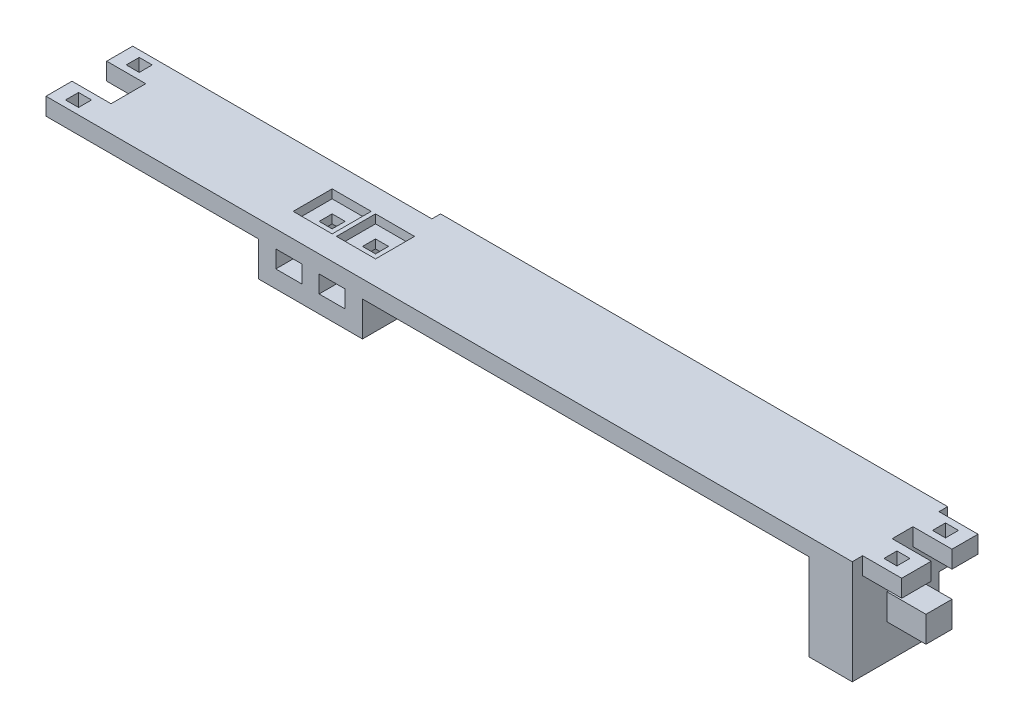
from build123d import *

# Parameters (mm, degrees)
SKETCH2_W           = 194.96
SKETCH2_H           = 6
BOSS_EXTRUDE1_DEPTH = 4
SKETCH3_W           = 176.96
SKETCH3_H           = 4
BOSS_EXTRUDE2_DEPTH = 14
SKETCH4_W           = 6
SKETCH4_H           = 4
BOSS_EXTRUDE3_DEPTH = 9
SKETCH5_W           = 6.8
SKETCH5_H           = 4
BOSS_EXTRUDE4_DEPTH = 9
CUT_EXTRUDE1_REACH  = 197.503
SKETCH6_W           = 3
SKETCH6_H           = 3
SKETCH7_W           = 10
SKETCH7_H           = 20
BOSS_EXTRUDE5_DEPTH = 20
SKETCH8_W           = 136.96
SKETCH8_H           = 6
BOSS_EXTRUDE6_DEPTH = 8
CHAMFER1_SIZE2      = 14.301043111
CHAMFER1_SIZE       = 12
BOSS_EXTRUDE7_DEPTH = 14
CUT_EXTRUDE2_REACH  = 199.001
SKETCH10_W          = 6
SKETCH10_H          = 4
CUT_EXTRUDE3_REACH  = 198.93
SKETCH11_W          = 3
SKETCH11_H          = 3
SKETCH12_W          = 116.96
SKETCH12_H          = 12
BOSS_EXTRUDE8_DEPTH = 2
SKETCH13_W          = 6
SKETCH13_H          = 6
BOSS_EXTRUDE9_DEPTH = 9
SKETCH14_W          = 9
SKETCH14_H          = 9
CUT_EXTRUDE4_DEPTH  = 2


with BuildPart() as part:
    # Sketch2 → Boss-Extrude1 (new body)
    with BuildSketch(Plane(origin=(0, 0, 0), x_dir=(1, 0, 0), z_dir=(0, 1, 0))):
        with Locations((97.48, 3)):
            Rectangle(SKETCH2_W, SKETCH2_H)
    extrude(amount=BOSS_EXTRUDE1_DEPTH)

    # Sketch3 → Boss-Extrude2 (add)
    with BuildSketch(Plane(origin=(0, 0, 0), x_dir=(-1, 0, 0), z_dir=(0, 0, -1))):
        with Locations((-97.48, 2)):
            Rectangle(SKETCH3_W, SKETCH3_H)
    extrude(amount=-BOSS_EXTRUDE2_DEPTH)

    # Sketch4 → Boss-Extrude3 (add)
    with BuildSketch(Plane.ZY.offset(-9)):
        with Locations((11, 2)):
            Rectangle(SKETCH4_W, SKETCH4_H)
    extrude(amount=BOSS_EXTRUDE3_DEPTH)

    # Sketch5 → Boss-Extrude4 (add)
    with BuildSketch(Plane(origin=(185.96, 0, 0), x_dir=(0, 0, -1), z_dir=(1, 0, 0))):
        with Locations((-8.2, 2)):
            Rectangle(SKETCH5_W, SKETCH5_H)
    extrude(amount=BOSS_EXTRUDE4_DEPTH)

    # Sketch6 → Cut-Extrude1 (cut, up to next)
    with BuildSketch(Plane(origin=(0, 4, 0), x_dir=(1, 0, 0), z_dir=(0, 1, 0)), mode=Mode.PRIVATE) as cut_extrude1_sk1:
        with Locations((4.5, 3)):
            Rectangle(SKETCH6_W, SKETCH6_H)
    cut_extrude1_tool1 = extrude(cut_extrude1_sk1.sketch, amount=-CUT_EXTRUDE1_REACH, mode=Mode.PRIVATE) & part.part
    # Sketch6 → Cut-Extrude1 (cut, up to next)
    with BuildSketch(Plane(origin=(0, 4, 0), x_dir=(1, 0, 0), z_dir=(0, 1, 0)), mode=Mode.PRIVATE) as cut_extrude1_sk2:
        with Locations((4.5, -11)):
            Rectangle(SKETCH6_W, SKETCH6_H)
    cut_extrude1_tool2 = extrude(cut_extrude1_sk2.sketch, amount=-CUT_EXTRUDE1_REACH, mode=Mode.PRIVATE) & part.part
    # Sketch6 → Cut-Extrude1 (cut, up to next)
    with BuildSketch(Plane(origin=(0, 4, 0), x_dir=(1, 0, 0), z_dir=(0, 1, 0)), mode=Mode.PRIVATE) as cut_extrude1_sk3:
        with Locations((190.46, 3)):
            Rectangle(SKETCH6_W, SKETCH6_H)
    cut_extrude1_tool3 = extrude(cut_extrude1_sk3.sketch, amount=-CUT_EXTRUDE1_REACH, mode=Mode.PRIVATE) & part.part
    # Sketch6 → Cut-Extrude1 (cut, up to next)
    with BuildSketch(Plane(origin=(0, 4, 0), x_dir=(1, 0, 0), z_dir=(0, 1, 0)), mode=Mode.PRIVATE) as cut_extrude1_sk4:
        with Locations((190.46, -8.2)):
            Rectangle(SKETCH6_W, SKETCH6_H)
    cut_extrude1_tool4 = extrude(cut_extrude1_sk4.sketch, amount=-CUT_EXTRUDE1_REACH, mode=Mode.PRIVATE) & part.part
    add(cut_extrude1_tool1.solids().sort_by_distance((4.5, 4, -3))[0], mode=Mode.SUBTRACT)
    add(cut_extrude1_tool2.solids().sort_by_distance((4.5, 4, 11))[0], mode=Mode.SUBTRACT)
    add(cut_extrude1_tool3.solids().sort_by_distance((190.46, 4, -3))[0], mode=Mode.SUBTRACT)
    add(cut_extrude1_tool4.solids().sort_by_distance((190.46, 4, 8.2))[0], mode=Mode.SUBTRACT)

    # Sketch7 → Boss-Extrude5 (add)
    with BuildSketch(Plane.XZ):
        with Locations((180.96, 4)):
            Rectangle(SKETCH7_W, SKETCH7_H)
    extrude(amount=BOSS_EXTRUDE5_DEPTH)

    # Sketch8 → Boss-Extrude6 (add)
    with BuildSketch(Plane.XZ):
        with Locations((117.48, -3)):
            Rectangle(SKETCH8_W, SKETCH8_H)
    extrude(amount=BOSS_EXTRUDE6_DEPTH)

    # Chamfer1
    chamfer1_edges = [part.edges().sort_by_distance(p)[0] for p in [
        (175.96, -8, -3),
    ]]
    chamfer1_side = [part.faces().sort_by_distance(p)[0] for p in [
        (175.96, -8.24, -3),
    ]]
    chamfer(chamfer1_edges, length=CHAMFER1_SIZE - 0.0001, length2=CHAMFER1_SIZE2 - 0.0001, reference=chamfer1_side[0])  # a hair under: the kernel refuses the full size

    # Sketch9 → Boss-Extrude7 (add)
    with BuildSketch(Plane.XY):
        Polygon((49, -8), (55, -8), (61, -8), (73, -8), (73, 0), (61, 0), (55, 0), (49, 0), align=None)
    extrude(amount=BOSS_EXTRUDE7_DEPTH)

    # Sketch10 → Cut-Extrude2 (cut, up to next)
    with BuildSketch(Plane.XY.offset(14), mode=Mode.PRIVATE) as cut_extrude2_sk1:
        with Locations((56, -2)):
            Rectangle(SKETCH10_W, SKETCH10_H)
    cut_extrude2_tool1 = extrude(cut_extrude2_sk1.sketch, amount=-CUT_EXTRUDE2_REACH, mode=Mode.PRIVATE) & part.part
    # Sketch10 → Cut-Extrude2 (cut, up to next)
    with BuildSketch(Plane.XY.offset(14), mode=Mode.PRIVATE) as cut_extrude2_sk2:
        with Locations((66, -2)):
            Rectangle(SKETCH10_W, SKETCH10_H)
    cut_extrude2_tool2 = extrude(cut_extrude2_sk2.sketch, amount=-CUT_EXTRUDE2_REACH, mode=Mode.PRIVATE) & part.part
    add(cut_extrude2_tool1.solids().sort_by_distance((56, -2, 14))[0], mode=Mode.SUBTRACT)
    add(cut_extrude2_tool2.solids().sort_by_distance((66, -2, 14))[0], mode=Mode.SUBTRACT)

    # Sketch11 → Cut-Extrude3 (cut, up to next)
    with BuildSketch(Plane(origin=(0, 4, 0), x_dir=(1, 0, 0), z_dir=(0, 1, 0)), mode=Mode.PRIVATE) as cut_extrude3_sk1:
        with Locations((56, -4)):
            Rectangle(SKETCH11_W, SKETCH11_H)
    cut_extrude3_tool1 = extrude(cut_extrude3_sk1.sketch, amount=-CUT_EXTRUDE3_REACH, mode=Mode.PRIVATE) & part.part
    # Sketch11 → Cut-Extrude3 (cut, up to next)
    with BuildSketch(Plane(origin=(0, 4, 0), x_dir=(1, 0, 0), z_dir=(0, 1, 0)), mode=Mode.PRIVATE) as cut_extrude3_sk2:
        with Locations((66, -4)):
            Rectangle(SKETCH11_W, SKETCH11_H)
    cut_extrude3_tool2 = extrude(cut_extrude3_sk2.sketch, amount=-CUT_EXTRUDE3_REACH, mode=Mode.PRIVATE) & part.part
    add(cut_extrude3_tool1.solids().sort_by_distance((56, 4, 4))[0], mode=Mode.SUBTRACT)
    add(cut_extrude3_tool2.solids().sort_by_distance((66, 4, 4))[0], mode=Mode.SUBTRACT)

    # Sketch12 → Boss-Extrude8 (add)
    with BuildSketch(Plane(origin=(0, 0, -6), x_dir=(-1, 0, 0), z_dir=(0, 0, -1))):
        with Locations((-127.48, -2)):
            Rectangle(SKETCH12_W, SKETCH12_H)
    extrude(amount=BOSS_EXTRUDE8_DEPTH)

    # Sketch13 → Boss-Extrude9 (add)
    with BuildSketch(Plane(origin=(185.96, 0, 0), x_dir=(0, 0, -1), z_dir=(1, 0, 0))):
        with Locations((-3, -9)):
            Rectangle(SKETCH13_W, SKETCH13_H)
    extrude(amount=BOSS_EXTRUDE9_DEPTH)

    # Sketch14 → Cut-Extrude4 (cut)
    with BuildSketch(Plane(origin=(0, 4, 0), x_dir=(1, 0, 0), z_dir=(0, 1, 0))):
        with Locations((66, -4)):
            Rectangle(SKETCH14_W, SKETCH14_H)
        with Locations((56, -4)):
            Rectangle(SKETCH14_W, SKETCH14_H)
    extrude(amount=-CUT_EXTRUDE4_DEPTH, mode=Mode.SUBTRACT)


solid = part.part
